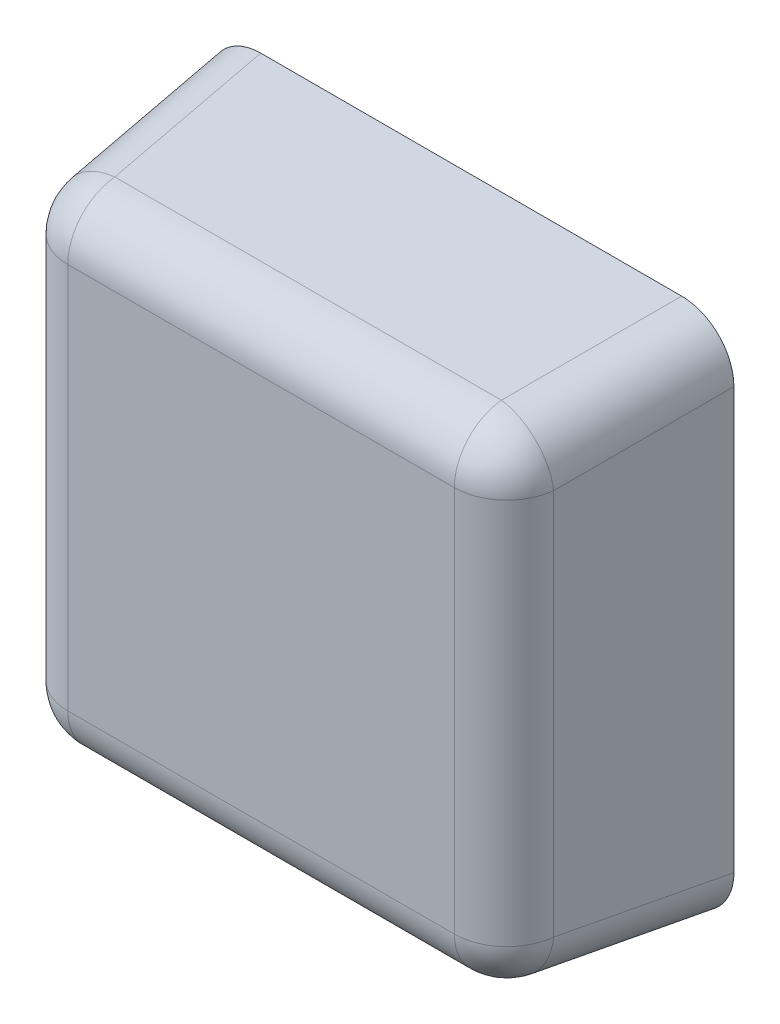
from build123d import *

# Parameters (mm, degrees)
SKETCH1_W           = 12.7
SKETCH1_H           = 12.7
BOSS_EXTRUDE1_DEPTH = 5.08
BOSS_EXTRUDE1_TAPER = 6
FILLET1_R           = 1.27


with BuildPart() as part:
    # Sketch1 → Boss-Extrude1 (new body)
    with BuildSketch(Plane.XY):
        with Locations((6.35, -6.35)):
            Rectangle(SKETCH1_W, SKETCH1_H)
    extrude(amount=BOSS_EXTRUDE1_DEPTH, taper=BOSS_EXTRUDE1_TAPER)

    # Fillet1
    fillet1_edges = [part.edges().sort_by_distance(p)[0] for p in [
        (6.35, -0.533929515, 5.08),
        (12.166070485, -6.35, 5.08),
        (6.35, -12.166070485, 5.08),
        (0.533929515, -6.35, 5.08),
        (12.433035242, -12.433035242, 2.54),
        (0.26696522, -12.43303478, 2.540004395),
        (0.266964758, -0.266964758, 2.54),
        (12.43303478, -0.26696522, 2.540004395),
    ]]
    fillet(fillet1_edges, radius=FILLET1_R)


solid = part.part
